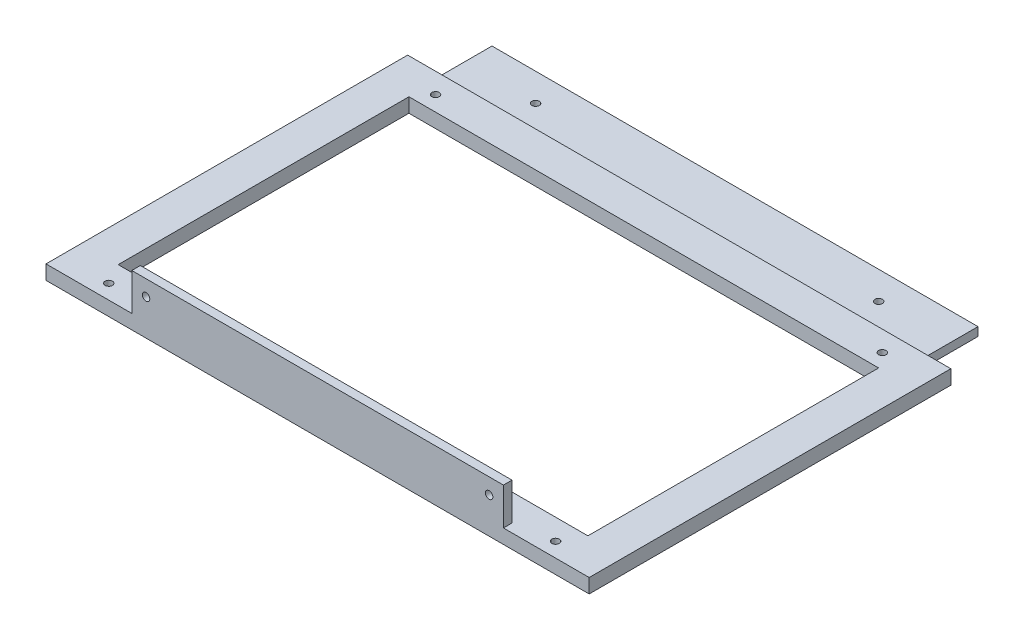
from build123d import *

# Parameters (mm, degrees)
SKETCH1_W           = 170
SKETCH1_H           = 146
BOSS_EXTRUDE1_DEPTH = 3
SKETCH2_R           = 1.3
CUT_EXTRUDE1_DEPTH  = 3
CUT_EXTRUDE2_DEPTH  = 3
BOSS_EXTRUDE2_START = 2
SKETCH4_R           = 1.3
SKETCH4_W           = 164.3
SKETCH4_H           = 101.7
BOSS_EXTRUDE2_DEPTH = 2
BOSS_EXTRUDE5_DEPTH = 10
SKETCH10_W          = 126.5
SKETCH10_H          = 5
BOSS_EXTRUDE6_DEPTH = 10
SKETCH12_W          = 190
SKETCH12_H          = 3
BOSS_EXTRUDE8_DEPTH = 13
SKETCH13_R          = 1.3
CUT_EXTRUDE3_DEPTH  = 13
FILLET4_R           = 2
SKETCH14_R          = 1.3
CUT_EXTRUDE4_DEPTH  = 13
SKETCH15_W          = 30
SKETCH15_H          = 3
CUT_EXTRUDE5_DEPTH  = 13


with BuildPart() as part:
    # Sketch1 → Boss-Extrude1 (new body)
    with BuildSketch(Plane(origin=(0, 0, 0), x_dir=(1, 0, 0), z_dir=(0, 1, 0))):
        Rectangle(SKETCH1_W, SKETCH1_H)
    extrude(amount=BOSS_EXTRUDE1_DEPTH)

    # Sketch2 → Cut-Extrude1 (cut)
    with BuildSketch(Plane(origin=(0, 3, 0), x_dir=(1, 0, 0), z_dir=(0, 1, 0))):
        with Locations(Location((78.15, -67.9, 0), (0, 0, 270))):
            Circle(SKETCH2_R)
        with Locations(Location((-78.15, 46.4, 0), (0, 0, 270))):
            Circle(SKETCH2_R)
        with Locations(Location((-78.15, -67.9, 0), (0, 0, 270))):
            Circle(SKETCH2_R)
        with Locations(Location((78.15, 46.4, 0), (0, 0, 270))):
            Circle(SKETCH2_R)
    extrude(amount=-CUT_EXTRUDE1_DEPTH, mode=Mode.SUBTRACT)

    # Sketch3 → Cut-Extrude2 (cut)
    with BuildSketch(Plane(origin=(0, 3, 0), x_dir=(1, 0, 0), z_dir=(0, 1, 0))):
        Polygon((-78.15, -60.6), (-82.15, -60.6), (-82.15, 41.1), (-78.15, 41.1), (78.15, 41.1), (82.15, 41.1), (82.15, -60.6), (78.15, -60.6), align=None)
    extrude(amount=-CUT_EXTRUDE2_DEPTH, mode=Mode.SUBTRACT)

    # Sketch4 → Boss-Extrude2 (add)
    with BuildSketch(Plane(origin=(0, 3, 0), x_dir=(1, 0, 0), z_dir=(0, 1, 0)).offset(BOSS_EXTRUDE2_START)):
        Polygon((-82.15, 53.5), (85, 53.5), (85, -73), (-85, -73), (-85, 53.5), align=None)
        with Locations(Location((-78.15, 46.4, 0), (0, 0, 270))):
            Circle(SKETCH4_R, mode=Mode.SUBTRACT)
        with Locations(Location((-78.15, -67.9, 0), (0, 0, 270))):
            Circle(SKETCH4_R, mode=Mode.SUBTRACT)
        with Locations(Location((78.15, -67.9, 0), (0, 0, 270))):
            Circle(SKETCH4_R, mode=Mode.SUBTRACT)
        with Locations(Location((78.15, 46.4, 0), (0, 0, 270))):
            Circle(SKETCH4_R, mode=Mode.SUBTRACT)
        with Locations((0, -9.75)):
            Rectangle(SKETCH4_W, SKETCH4_H, mode=Mode.SUBTRACT)
    extrude(amount=-BOSS_EXTRUDE2_DEPTH)

    # Sketch9 → Boss-Extrude5 (add)
    with BuildSketch(Plane.ZY.offset(85)):
        Polygon((-53.5, 3), (-53.5, 5), (73, 5), (73, 0), (-53.5, 0), align=None)
    extrude(amount=BOSS_EXTRUDE5_DEPTH)

    # Sketch10 → Boss-Extrude6 (add)
    with BuildSketch(Plane(origin=(85, 0, 0), x_dir=(0, 0, -1), z_dir=(1, 0, 0))):
        with Locations((-9.75, 2.5)):
            Rectangle(SKETCH10_W, SKETCH10_H)
    extrude(amount=BOSS_EXTRUDE6_DEPTH)

    # Sketch12 → Boss-Extrude8 (add)
    with BuildSketch(Plane(origin=(0, 5, 0), x_dir=(1, 0, 0), z_dir=(0, 1, 0))):
        with Locations((0, -71.5)):
            Rectangle(SKETCH12_W, SKETCH12_H)
    extrude(amount=BOSS_EXTRUDE8_DEPTH)

    # Sketch13 → Cut-Extrude3 (cut)
    with BuildSketch(Plane(origin=(0, 3, 0), x_dir=(1, 0, 0), z_dir=(0, 1, 0))):
        with Locations(Location((-60, 63.25, 0), (0, 0, 270))):
            Circle(SKETCH13_R)
        with Locations(Location((60, 63.25, 0), (0, 0, 270))):
            Circle(SKETCH13_R)
    extrude(amount=-CUT_EXTRUDE3_DEPTH, mode=Mode.SUBTRACT)

    # Fillet4
    fillet4_edges = [part.edges().sort_by_distance(p)[0] for p in [
        (0, 3, -53.5),
    ]]
    fillet(fillet4_edges, radius=FILLET4_R - 0.0001)  # a hair under: the kernel refuses the full size

    # Sketch14 → Cut-Extrude4 (cut)
    with BuildSketch(Plane(origin=(0, 0, 70), x_dir=(-1, 0, 0), z_dir=(0, 0, -1))):
        with Locations((-60, 12.5)):
            Circle(SKETCH14_R)
        with Locations((60, 12.5)):
            Circle(SKETCH14_R)
    extrude(amount=-CUT_EXTRUDE4_DEPTH, mode=Mode.SUBTRACT)

    # Sketch15 → Cut-Extrude5 (cut)
    with BuildSketch(Plane(origin=(0, 18, 0), x_dir=(1, 0, 0), z_dir=(0, 1, 0))):
        with Locations((80, -71.5)):
            Rectangle(SKETCH15_W, SKETCH15_H)
        with Locations((-80, -71.5)):
            Rectangle(SKETCH15_W, SKETCH15_H)
    extrude(amount=-CUT_EXTRUDE5_DEPTH, mode=Mode.SUBTRACT)


solid = part.part
